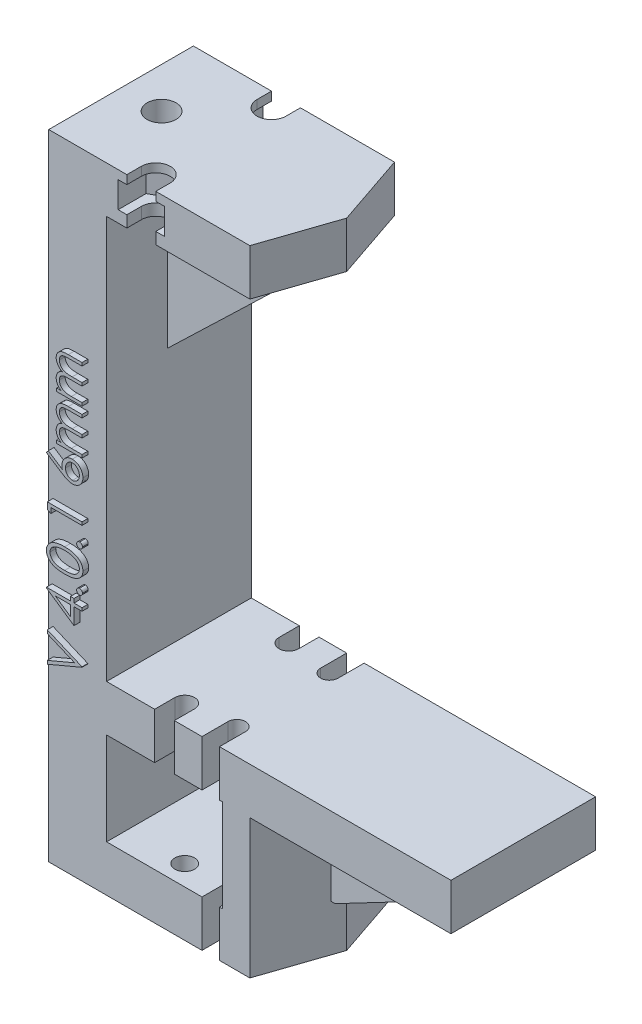
from build123d import *
from build123d.topology import SkipClean

# Parameters (mm, degrees)
BOSS_EXTRUDE2_DEPTH       = 12.5
BOSS_EXTRUDE3_DEPTH       = 25
CUT_EXTRUDE2_REACH        = 115.118
CUT_EXTRUDE3_REACH        = 115.118
BOSS_EXTRUDE5_DEPTH       = 2
CUT_EXTRUDE6_REACH        = 115.118
SKETCH30_W                = 10
SKETCH30_H                = 25
CUT_EXTRUDE8_DEPTH        = 8
CUT_EXTRUDE9_DEPTH        = 83.489769669
CUT_EXTRUDE9_DEPTH_BACK   = 83.489769669
BOSS_EXTRUDE6_DEPTH       = 1
BOSS_EXTRUDE7_DEPTH       = 40
BOSS_EXTRUDE17_DEPTH      = 2
CUT_EXTRUDE11_START       = -6
CUT_EXTRUDE11_DEPTH       = 4.5
SKETCH39_W                = 4
SKETCH39_H                = 16
BOSS_EXTRUDE18_DEPTH      = 2.5
F_5_0MM_DOWEL_HOLE1_D     = 5
F_5_0MM_DOWEL_HOLE1_DEPTH = 5
F_5_0MM_DOWEL_HOLE1_TIP   = 1.502151548
BOSS_EXTRUDE20_DEPTH      = 8


# Read off the part's stored shape, not the designer's step: Cut-Extrude11
with BuildPart() as part:
    # Sketch6 → Boss-Extrude2 (new, symmetric)
    with BuildSketch(Plane.XY):
        Polygon((-25, 54.805), (15, 54.805), (15, 46.805), (-15, 46.805), (-15, -46.805), (25, -46.805), (25, -54.805), (-25, -54.805), align=None)
    extrude(amount=BOSS_EXTRUDE2_DEPTH, both=True)

    # Sketch15 → Boss-Extrude3 (add)
    with BuildSketch(Plane.XY.offset(12.5)):
        Polygon((-15, -22.805), (15, -22.805), (15, -54.805), (5, -54.805), (5, -30.805), (-15, -30.805), align=None)
    extrude(amount=-BOSS_EXTRUDE3_DEPTH)

    # Sketch20 → Cut-Extrude2 (cut, up to next)
    with BuildSketch(Plane(origin=(0, 54.805, 0), x_dir=(1, 0, 0), z_dir=(0, 1, 0)), mode=Mode.PRIVATE) as cut_extrude2_sk1:
        with BuildLine():
            Line((-11.5, 12.5), (-11.5, 10))
            ThreePointArc((-11.5, 10), (-9, 7.5), (-6.5, 10))
            Line((-6.5, 10), (-6.5, 12.5))
            Line((-6.5, 12.5), (-11.5, 12.5))
        make_face()
    cut_extrude2_tool1 = extrude(cut_extrude2_sk1.sketch, amount=-CUT_EXTRUDE2_REACH, mode=Mode.PRIVATE) & part.part
    # Sketch20 → Cut-Extrude2 (cut, up to next)
    with BuildSketch(Plane(origin=(0, 54.805, 0), x_dir=(1, 0, 0), z_dir=(0, 1, 0)), mode=Mode.PRIVATE) as cut_extrude2_sk2:
        with BuildLine():
            Line((-6.5, -12.5), (-11.5, -12.5))
            Line((-11.5, -12.5), (-11.5, -10))
            ThreePointArc((-11.5, -10), (-9, -7.5), (-6.5, -10))
            Line((-6.5, -10), (-6.5, -12.5))
        make_face()
    cut_extrude2_tool2 = extrude(cut_extrude2_sk2.sketch, amount=-CUT_EXTRUDE2_REACH, mode=Mode.PRIVATE) & part.part
    add(cut_extrude2_tool1.solids().sort_by_distance((-9, 54.805, -10.233375))[0], mode=Mode.SUBTRACT)
    add(cut_extrude2_tool2.solids().sort_by_distance((-9, 54.805, 10.233375))[0], mode=Mode.SUBTRACT)

    # Cut-Extrude3: up to this face of the body (flat: up to its plane)
    cut_extrude3_end = Plane(part.part.faces().sort_by_distance((0, -22.805, 0))[0])
    # Sketch21 → Cut-Extrude3 (cut, up to the picked face)
    with BuildSketch(Plane.XZ.offset(54.805), mode=Mode.PRIVATE) as cut_extrude3_sk1:
        with BuildLine():
            Line((-6.7, 12.5), (-6.7, 9))
            ThreePointArc((-6.7, 9), (-5, 7.3), (-3.3, 9))
            Line((-3.3, 9), (-3.3, 12.5))
            Line((-3.3, 12.5), (-6.7, 12.5))
        make_face()
    cut_extrude3_tool1 = split(extrude(cut_extrude3_sk1.sketch, amount=-CUT_EXTRUDE3_REACH, mode=Mode.PRIVATE), bisect_by=cut_extrude3_end, keep=Keep.BOTH, mode=Mode.PRIVATE)
    # Sketch21 → Cut-Extrude3 (cut, up to the picked face)
    with BuildSketch(Plane.XZ.offset(54.805), mode=Mode.PRIVATE) as cut_extrude3_sk2:
        with BuildLine():
            Line((-3.3, -12.5), (-6.7, -12.5))
            Line((-6.7, -12.5), (-6.7, -9))
            ThreePointArc((-6.7, -9), (-5, -7.3), (-3.3, -9))
            Line((-3.3, -9), (-3.3, -12.5))
        make_face()
    cut_extrude3_tool2 = split(extrude(cut_extrude3_sk2.sketch, amount=-CUT_EXTRUDE3_REACH, mode=Mode.PRIVATE), bisect_by=cut_extrude3_end, keep=Keep.BOTH, mode=Mode.PRIVATE)
    add(cut_extrude3_tool1.solids().sort_by(Axis((-5, -54.805, 10.067524), (0, 1, 0)))[0], mode=Mode.SUBTRACT)
    add(cut_extrude3_tool2.solids().sort_by(Axis((-5, -54.805, -10.067524), (0, 1, 0)))[0], mode=Mode.SUBTRACT)

    # Sketch22 → Boss-Extrude5 (add, symmetric)
    with BuildSketch(Plane.XY):
        Polygon((-15, 21.805), (11, 46.805), (-15, 46.805), align=None)
    extrude(amount=BOSS_EXTRUDE5_DEPTH, both=True)

    # Cut-Extrude6: up to this face of the body (flat: up to its plane)
    cut_extrude6_end = Plane(part.part.faces().sort_by_distance((0.229244521, -22.805, 0))[0])
    # Sketch24 → Cut-Extrude6 (cut, up to the picked face)
    with BuildSketch(Plane.XZ.offset(54.805), mode=Mode.PRIVATE) as cut_extrude6_sk1:
        with BuildLine():
            Line((1.49, -12.5), (1.49, -8))
            ThreePointArc((1.49, -8), (3, -6.49), (4.51, -8))
            Line((4.51, -8), (4.51, -12.5))
            Line((4.51, -12.5), (1.49, -12.5))
        make_face()
    cut_extrude6_tool1 = split(extrude(cut_extrude6_sk1.sketch, amount=-CUT_EXTRUDE6_REACH, mode=Mode.PRIVATE), bisect_by=cut_extrude6_end, keep=Keep.BOTH, mode=Mode.PRIVATE)
    # Sketch24 → Cut-Extrude6 (cut, up to the picked face)
    with BuildSketch(Plane.XZ.offset(54.805), mode=Mode.PRIVATE) as cut_extrude6_sk2:
        with BuildLine():
            Line((4.51, 12.5), (1.49, 12.5))
            Line((1.49, 12.5), (1.49, 8))
            ThreePointArc((1.49, 8), (3, 6.49), (4.51, 8))
            Line((4.51, 8), (4.51, 12.5))
        make_face()
    cut_extrude6_tool2 = split(extrude(cut_extrude6_sk2.sketch, amount=-CUT_EXTRUDE6_REACH, mode=Mode.PRIVATE), bisect_by=cut_extrude6_end, keep=Keep.BOTH, mode=Mode.PRIVATE)
    add(cut_extrude6_tool1.solids().sort_by(Axis((3, -54.805, -9.647036), (0, 1, 0)))[0], mode=Mode.SUBTRACT)
    add(cut_extrude6_tool2.solids().sort_by(Axis((3, -54.805, 9.647036), (0, 1, 0)))[0], mode=Mode.SUBTRACT)

    # Sketch30 → Cut-Extrude8 (cut)
    with BuildSketch(Plane(origin=(0, -46.805, 0), x_dir=(1, 0, 0), z_dir=(0, 1, 0))):
        with Locations((20, 0)):
            Rectangle(SKETCH30_W, SKETCH30_H)
    extrude(amount=-CUT_EXTRUDE8_DEPTH, mode=Mode.SUBTRACT)

    # Sketch34 → Cut-Extrude9 (cut, two sides: drawn at the far end of the back side and taken through both)
    with BuildSketch(Plane(origin=(0, -22.805, 0), x_dir=(1, 0, 0), z_dir=(0, 1, 0)).offset(-CUT_EXTRUDE9_DEPTH_BACK)):
        Polygon((9.755, 12.5), (14, 0), (9.755, -12.5), (15, -12.5), (15, 12.5), align=None)
    extrude(amount=CUT_EXTRUDE9_DEPTH + CUT_EXTRUDE9_DEPTH_BACK, mode=Mode.SUBTRACT)

    # Sketch35 → Boss-Extrude6 (add)
    # profile 1 of 9: a face of its own
    with BuildSketch(Plane.XY.offset(12.5)):
        with BuildLine():
            Line((-22.634615385, 17.269230769), (-22.634615385, 17.807692308))
            Line((-22.634615385, 17.807692308), (-21.872596154, 17.807692308))
            add(Edge.make_bspline(
                [(-21.872596154, 17.807692308), (-21.939260614, 17.856179079), (-22.066996111, 17.949084381), (-22.235322312, 18.1014255), (-22.378170577, 18.253613121), (-22.453158357, 18.363213204), (-22.489182692, 18.415865385)],
                knots=[0, 0, 0, 0, 1.134379233, 2.173579362, 3.122582517, 4, 4, 4, 4], degree=3))
            add(Edge.make_bspline(
                [(-22.489182692, 18.415865385), (-22.523477604, 18.487633377), (-22.591468256, 18.629915491), (-22.660440071, 18.855205591), (-22.702825959, 19.085733596), (-22.708622599, 19.241404819), (-22.711538462, 19.319711538)],
                knots=[0, 0, 0, 0, 1.014936303, 2.012140481, 3.000054389, 4, 4, 4, 4], degree=3))
            add(Edge.make_bspline(
                [(-22.711538462, 19.319711538), (-22.709746507, 19.372670933), (-22.706200324, 19.477474728), (-22.683126386, 19.632762148), (-22.643239974, 19.783375365), (-22.587690322, 19.928433755), (-22.520389321, 20.065076782), (-22.441520642, 20.190446325), (-22.352811526, 20.30245663), (-22.251715073, 20.402902873), (-22.132621113, 20.492431534), (-21.993245652, 20.574208096), (-21.831579845, 20.65077394), (-21.714358593, 20.692943109), (-21.652644231, 20.715144231)],
                knots=[0, 0, 0, 0, 1.009731074, 1.9982035, 2.985760524, 3.974587072, 4.955028184, 5.885388378, 6.793242796, 7.673688873, 8.594941726, 9.625945874, 10.750113716, 12, 12, 12, 12], degree=3))
            add(Edge.make_bspline(
                [(-21.652644231, 20.715144231), (-21.695028488, 20.738649663), (-21.778434755, 20.784905052), (-21.896484081, 20.862565718), (-22.00687165, 20.943961513), (-22.109826129, 21.029654503), (-22.20452798, 21.120004571), (-22.292909205, 21.213555985), (-22.372522012, 21.312403764), (-22.465676161, 21.449129125), (-22.564941217, 21.626834374), (-22.648837086, 21.851761087), (-22.702266055, 22.084848957), (-22.708427236, 22.243302618), (-22.711538462, 22.323317308)],
                knots=[0, 0, 0, 0, 0.861026002, 1.694378253, 2.508904292, 3.297437177, 4.073006284, 4.833627155, 5.583069468, 6.325614666, 7.772320565, 9.187282923, 10.579656144, 12, 12, 12, 12], degree=3))
            add(Edge.make_bspline(
                [(-22.711538462, 22.323317308), (-22.708800813, 22.396841161), (-22.70344297, 22.54073448), (-22.660375554, 22.749864459), (-22.589095041, 22.945734478), (-22.488852441, 23.126268515), (-22.363482389, 23.289368748), (-22.214139706, 23.431680227), (-22.041369838, 23.55007394), (-21.880136821, 23.629223374), (-21.737524673, 23.681914306), (-21.615460368, 23.714821929), (-21.481004779, 23.743331908), (-21.334266049, 23.767504072), (-21.174947077, 23.784979438), (-21.002974661, 23.797970421), (-20.818199364, 23.806750853), (-20.690715767, 23.807372077), (-20.625, 23.807692308)],
                knots=[0, 0, 0, 0, 1.209392158, 2.366897878, 3.497663982, 4.628180075, 5.751982922, 6.871462727, 8.009245026, 9.185977379, 9.818124946, 10.509294143, 11.264649411, 12.079922034, 12.956003306, 13.901808055, 14.918415426, 16, 16, 16, 16], degree=3))
            Line((-20.625, 23.807692308), (-18.25, 23.807692308))
            Line((-18.25, 23.807692308), (-18.25, 23.269230769))
            Line((-18.25, 23.269230769), (-20.627403846, 23.269230769))
            add(Edge.make_bspline(
                [(-20.627403846, 23.269230769), (-20.683496341, 23.269097904), (-20.791297586, 23.268842556), (-20.946014988, 23.26421638), (-21.087050044, 23.255543984), (-21.214586843, 23.24524779), (-21.328585361, 23.231330295), (-21.428726359, 23.212954863), (-21.515466742, 23.193642495), (-21.611587244, 23.161482267), (-21.717531947, 23.110546589), (-21.830954892, 23.031547572), (-21.930458078, 22.933508005), (-22.016841526, 22.819678133), (-22.087129696, 22.690185901), (-22.137313417, 22.54744097), (-22.168382244, 22.392361242), (-22.171478124, 22.285007677), (-22.173076923, 22.229567308)],
                knots=[0, 0, 0, 0, 1.253367865, 2.408782419, 3.458086102, 4.410454771, 5.267690823, 6.022776742, 6.685072793, 7.251272234, 8.28433411, 9.300106008, 10.325693114, 11.39283262, 12.482417211, 13.60372085, 14.762494729, 16, 16, 16, 16], degree=3))
            add(Edge.make_bspline(
                [(-22.173076923, 22.229567308), (-22.16997183, 22.161617134), (-22.163840459, 22.02744157), (-22.117743069, 21.830434893), (-22.041126709, 21.64313437), (-21.936341225, 21.466804552), (-21.807618816, 21.30609247), (-21.655294615, 21.167323536), (-21.482742522, 21.052776353), (-21.32307314, 20.975194285), (-21.179638783, 20.926180609), (-21.054327211, 20.893835916), (-20.911520556, 20.868524428), (-20.752893327, 20.8452455), (-20.577094809, 20.829534991), (-20.385210505, 20.815656481), (-20.175926859, 20.809077948), (-20.03085208, 20.808165864), (-19.955528846, 20.807692308)],
                knots=[0, 0, 0, 0, 1.091136677, 2.154576964, 3.231646693, 4.331257757, 5.439166191, 6.528231045, 7.628049365, 8.756709726, 9.369482423, 10.061167346, 10.833871401, 11.698739631, 12.636505159, 13.668922441, 14.789697963, 16, 16, 16, 16], degree=3))
            Line((-19.955528846, 20.807692308), (-18.25, 20.807692308))
            Line((-18.25, 20.807692308), (-18.25, 20.269230769))
            Line((-18.25, 20.269230769), (-20.479567308, 20.269230769))
            add(Edge.make_bspline(
                [(-20.479567308, 20.269230769), (-20.54247014, 20.269094602), (-20.663488866, 20.268832629), (-20.837032312, 20.264244659), (-20.994885583, 20.255524728), (-21.136865264, 20.245443812), (-21.262713168, 20.230940575), (-21.373104451, 20.214466924), (-21.467760922, 20.195011474), (-21.57158701, 20.162802895), (-21.685945136, 20.113560705), (-21.807983755, 20.034450534), (-21.914604324, 19.935263645), (-22.007034555, 19.820195313), (-22.082563185, 19.689716261), (-22.13505501, 19.545269522), (-22.167080197, 19.38922123), (-22.171040318, 19.281407719), (-22.173076923, 19.225961538)],
                knots=[0, 0, 0, 0, 1.320285835, 2.540097241, 3.643286278, 4.638464947, 5.527188413, 6.301437306, 6.980978976, 7.552872752, 8.580906713, 9.583871393, 10.589652407, 11.624542289, 12.671761011, 13.738681301, 14.837052193, 16, 16, 16, 16], degree=3))
            add(Edge.make_bspline(
                [(-22.173076923, 19.225961538), (-22.170453269, 19.160790907), (-22.165224419, 19.030908152), (-22.118160076, 18.84010453), (-22.044438314, 18.655844312), (-21.942166243, 18.481061128), (-21.815474903, 18.320490875), (-21.666504635, 18.179853397), (-21.497243672, 18.062067556), (-21.339930706, 17.983138428), (-21.200047184, 17.932537066), (-21.080645905, 17.899361166), (-20.948314964, 17.870241312), (-20.802780158, 17.848840171), (-20.64469108, 17.828115401), (-20.473236398, 17.818125243), (-20.288570334, 17.808401202), (-20.161074488, 17.807934402), (-20.094951923, 17.807692308)],
                knots=[0, 0, 0, 0, 1.09880202, 2.189873405, 3.297736452, 4.440485332, 5.596193377, 6.739822772, 7.886349079, 9.066114917, 9.699498033, 10.395421758, 11.156987371, 11.985484089, 12.878178647, 13.847820956, 14.883825601, 16, 16, 16, 16], degree=3))
            Line((-20.094951923, 17.807692308), (-18.25, 17.807692308))
            Line((-18.25, 17.807692308), (-18.25, 17.269230769))
            Line((-18.25, 17.269230769), (-22.634615385, 17.269230769))
        make_face()
    # profile 2 of 9: a face of its own
    with BuildSketch(Plane.XY.offset(12.5)):
        with BuildLine():
            Line((-22.634615385, 9.5), (-22.634615385, 10.038461538))
            Line((-22.634615385, 10.038461538), (-21.872596154, 10.038461538))
            add(Edge.make_bspline(
                [(-21.872596154, 10.038461538), (-21.939260614, 10.08694831), (-22.066996111, 10.179853612), (-22.235322312, 10.33219473), (-22.378170577, 10.484382352), (-22.453158357, 10.593982435), (-22.489182692, 10.646634615)],
                knots=[0, 0, 0, 0, 1.134379233, 2.173579362, 3.122582517, 4, 4, 4, 4], degree=3))
            add(Edge.make_bspline(
                [(-22.489182692, 10.646634615), (-22.523477604, 10.718402608), (-22.591468256, 10.860684722), (-22.660440071, 11.085974821), (-22.702825959, 11.316502826), (-22.708622599, 11.47217405), (-22.711538462, 11.550480769)],
                knots=[0, 0, 0, 0, 1.014936303, 2.012140481, 3.000054389, 4, 4, 4, 4], degree=3))
            add(Edge.make_bspline(
                [(-22.711538462, 11.550480769), (-22.709746507, 11.603440164), (-22.706200324, 11.708243958), (-22.683126386, 11.863531379), (-22.643239974, 12.014144596), (-22.587690322, 12.159202985), (-22.520389321, 12.295846013), (-22.441520642, 12.421215556), (-22.352811526, 12.533225861), (-22.251715073, 12.633672104), (-22.132621113, 12.723200764), (-21.993245652, 12.804977327), (-21.831579845, 12.881543171), (-21.714358593, 12.923712339), (-21.652644231, 12.945913462)],
                knots=[0, 0, 0, 0, 1.009731074, 1.9982035, 2.985760524, 3.974587072, 4.955028184, 5.885388378, 6.793242796, 7.673688873, 8.594941726, 9.625945874, 10.750113716, 12, 12, 12, 12], degree=3))
            add(Edge.make_bspline(
                [(-21.652644231, 12.945913462), (-21.695028488, 12.969418894), (-21.778434755, 13.015674283), (-21.896484081, 13.093334949), (-22.00687165, 13.174730744), (-22.109826129, 13.260423733), (-22.20452798, 13.350773802), (-22.292909205, 13.444325216), (-22.372522012, 13.543172995), (-22.465676161, 13.679898355), (-22.564941217, 13.857603604), (-22.648837086, 14.082530318), (-22.702266055, 14.315618188), (-22.708427236, 14.474071849), (-22.711538462, 14.554086538)],
                knots=[0, 0, 0, 0, 0.861026002, 1.694378253, 2.508904292, 3.297437177, 4.073006284, 4.833627155, 5.583069468, 6.325614666, 7.772320565, 9.187282923, 10.579656144, 12, 12, 12, 12], degree=3))
            add(Edge.make_bspline(
                [(-22.711538462, 14.554086538), (-22.708800813, 14.627610392), (-22.70344297, 14.771503711), (-22.660375554, 14.98063369), (-22.589095041, 15.176503709), (-22.488852441, 15.357037746), (-22.363482389, 15.520137979), (-22.214139706, 15.662449458), (-22.041369838, 15.780843171), (-21.880136821, 15.859992605), (-21.737524673, 15.912683537), (-21.615460368, 15.945591159), (-21.481004779, 15.974101139), (-21.334266049, 15.998273303), (-21.174947077, 16.015748669), (-21.002974661, 16.028739652), (-20.818199364, 16.037520084), (-20.690715767, 16.038141308), (-20.625, 16.038461538)],
                knots=[0, 0, 0, 0, 1.209392158, 2.366897878, 3.497663982, 4.628180075, 5.751982922, 6.871462727, 8.009245026, 9.185977379, 9.818124946, 10.509294143, 11.264649411, 12.079922034, 12.956003306, 13.901808055, 14.918415426, 16, 16, 16, 16], degree=3))
            Line((-20.625, 16.038461538), (-18.25, 16.038461538))
            Line((-18.25, 16.038461538), (-18.25, 15.5))
            Line((-18.25, 15.5), (-20.627403846, 15.5))
            add(Edge.make_bspline(
                [(-20.627403846, 15.5), (-20.683496341, 15.499867134), (-20.791297586, 15.499611787), (-20.946014988, 15.494985611), (-21.087050044, 15.486313215), (-21.214586843, 15.476017021), (-21.328585361, 15.462099526), (-21.428726359, 15.443724094), (-21.515466742, 15.424411726), (-21.611587244, 15.392251498), (-21.717531947, 15.34131582), (-21.830954892, 15.262316803), (-21.930458078, 15.164277236), (-22.016841526, 15.050447363), (-22.087129696, 14.920955131), (-22.137313417, 14.778210201), (-22.168382244, 14.623130473), (-22.171478124, 14.515776908), (-22.173076923, 14.460336538)],
                knots=[0, 0, 0, 0, 1.253367865, 2.408782419, 3.458086102, 4.410454771, 5.267690823, 6.022776742, 6.685072793, 7.251272234, 8.28433411, 9.300106008, 10.325693114, 11.39283262, 12.482417211, 13.60372085, 14.762494729, 16, 16, 16, 16], degree=3))
            add(Edge.make_bspline(
                [(-22.173076923, 14.460336538), (-22.16997183, 14.392386365), (-22.163840459, 14.258210801), (-22.117743069, 14.061204124), (-22.041126709, 13.873903601), (-21.936341225, 13.697573783), (-21.807618816, 13.536861701), (-21.655294615, 13.398092767), (-21.482742522, 13.283545584), (-21.32307314, 13.205963516), (-21.179638783, 13.15694984), (-21.054327211, 13.124605147), (-20.911520556, 13.099293659), (-20.752893327, 13.076014731), (-20.577094809, 13.060304222), (-20.385210505, 13.046425711), (-20.175926859, 13.039847179), (-20.03085208, 13.038935095), (-19.955528846, 13.038461538)],
                knots=[0, 0, 0, 0, 1.091136677, 2.154576964, 3.231646693, 4.331257757, 5.439166191, 6.528231045, 7.628049365, 8.756709726, 9.369482423, 10.061167346, 10.833871401, 11.698739631, 12.636505159, 13.668922441, 14.789697963, 16, 16, 16, 16], degree=3))
            Line((-19.955528846, 13.038461538), (-18.25, 13.038461538))
            Line((-18.25, 13.038461538), (-18.25, 12.5))
            Line((-18.25, 12.5), (-20.479567308, 12.5))
            add(Edge.make_bspline(
                [(-20.479567308, 12.5), (-20.54247014, 12.499863832), (-20.663488866, 12.49960186), (-20.837032312, 12.495013889), (-20.994885583, 12.486293959), (-21.136865264, 12.476213043), (-21.262713168, 12.461709805), (-21.373104451, 12.445236155), (-21.467760922, 12.425780704), (-21.57158701, 12.393572126), (-21.685945136, 12.344329936), (-21.807983755, 12.265219765), (-21.914604324, 12.166032876), (-22.007034555, 12.050964543), (-22.082563185, 11.920485491), (-22.13505501, 11.776038753), (-22.167080197, 11.619990461), (-22.171040318, 11.51217695), (-22.173076923, 11.456730769)],
                knots=[0, 0, 0, 0, 1.320285835, 2.540097241, 3.643286278, 4.638464947, 5.527188413, 6.301437306, 6.980978976, 7.552872752, 8.580906713, 9.583871393, 10.589652407, 11.624542289, 12.671761011, 13.738681301, 14.837052193, 16, 16, 16, 16], degree=3))
            add(Edge.make_bspline(
                [(-22.173076923, 11.456730769), (-22.170453269, 11.391560137), (-22.165224419, 11.261677383), (-22.118160076, 11.070873761), (-22.044438314, 10.886613543), (-21.942166243, 10.711830359), (-21.815474903, 10.551260106), (-21.666504635, 10.410622628), (-21.497243672, 10.292836786), (-21.339930706, 10.213907659), (-21.200047184, 10.163306297), (-21.080645905, 10.130130397), (-20.948314964, 10.101010543), (-20.802780158, 10.079609402), (-20.64469108, 10.058884632), (-20.473236398, 10.048894474), (-20.288570334, 10.039170433), (-20.161074488, 10.038703633), (-20.094951923, 10.038461538)],
                knots=[0, 0, 0, 0, 1.09880202, 2.189873405, 3.297736452, 4.440485332, 5.596193377, 6.739822772, 7.886349079, 9.066114917, 9.699498033, 10.395421758, 11.156987371, 11.985484089, 12.878178647, 13.847820956, 14.883825601, 16, 16, 16, 16], degree=3))
            Line((-20.094951923, 10.038461538), (-18.25, 10.038461538))
            Line((-18.25, 10.038461538), (-18.25, 9.5))
            Line((-18.25, 9.5), (-22.634615385, 9.5))
        make_face()
    # profile 3 of 9: a face of its own
    with BuildSketch(Plane.XY.offset(12.5)):
        with BuildLine():
            Line((-24.403846154, 7.269230769), (-24.078125, 7.683894231))
            Line((-24.078125, 7.683894231), (-21.653846154, 6.098557692))
            add(Edge.make_bspline(
                [(-21.653846154, 6.098557692), (-21.670669915, 6.204106739), (-21.703486563, 6.409992087), (-21.708900184, 6.618390771), (-21.711538462, 6.719951923)],
                knots=[0, 0, 0, 0, 1.025318673, 2, 2, 2, 2], degree=3))
            add(Edge.make_bspline(
                [(-21.711538462, 6.719951923), (-21.709899413, 6.780933345), (-21.706672995, 6.900973461), (-21.681843536, 7.077213691), (-21.642714775, 7.24656616), (-21.585676611, 7.408328899), (-21.512815472, 7.563082672), (-21.425491544, 7.711715012), (-21.319196668, 7.851434042), (-21.200454525, 7.984031063), (-21.068947951, 8.104438983), (-20.929372943, 8.210959201), (-20.781740538, 8.300924423), (-20.626083938, 8.372600215), (-20.463621598, 8.429881866), (-20.293719906, 8.47065943), (-20.116092105, 8.495036871), (-19.995268777, 8.498328138), (-19.933894231, 8.5)],
                knots=[0, 0, 0, 0, 1.043709831, 2.054511743, 3.041122595, 4.01515914, 4.98481438, 5.965901842, 6.960491961, 7.985277438, 9.0096037, 10.00832444, 10.987059228, 11.962929573, 12.936966118, 13.931840027, 14.949438142, 16, 16, 16, 16], degree=3))
            add(Edge.make_bspline(
                [(-19.933894231, 8.5), (-19.849925882, 8.497566321), (-19.684696042, 8.492777416), (-19.444095149, 8.44485764), (-19.215016278, 8.37095082), (-19.001423329, 8.26362202), (-18.801836938, 8.132834364), (-18.625572893, 7.971381106), (-18.468373459, 7.787272661), (-18.336976256, 7.578987195), (-18.229652901, 7.354862474), (-18.152570648, 7.119400295), (-18.105113004, 6.874897039), (-18.099163435, 6.708946225), (-18.096153846, 6.625)],
                knots=[0, 0, 0, 0, 1.031403119, 2.029557249, 3.004870281, 3.983165322, 4.960181699, 5.929903783, 6.912123683, 7.928973898, 8.949315281, 9.960468141, 10.968302741, 12, 12, 12, 12], degree=3))
            add(Edge.make_bspline(
                [(-18.096153846, 6.625), (-18.098766183, 6.544259401), (-18.103940764, 6.38432641), (-18.150276973, 6.149119892), (-18.224845886, 5.922714882), (-18.329732025, 5.7080176), (-18.459978665, 5.508802902), (-18.615685436, 5.329151298), (-18.797068655, 5.173877592), (-19.000160456, 5.043494415), (-19.218092402, 4.939644242), (-19.445725188, 4.862493147), (-19.682103161, 4.817189725), (-19.84235951, 4.810873596), (-19.923076923, 4.807692308)],
                knots=[0, 0, 0, 0, 1.012172929, 2.004937354, 2.995255351, 3.995689452, 4.993936421, 5.973737378, 6.968231049, 7.979117505, 8.993136101, 9.989812463, 10.987515067, 12, 12, 12, 12], degree=3))
            add(Edge.make_bspline(
                [(-19.923076923, 4.807692308), (-19.984867637, 4.809717642), (-20.111032469, 4.813852988), (-20.30211366, 4.842727371), (-20.4976298, 4.889124162), (-20.663494132, 4.941084584), (-20.799371027, 4.99598563), (-20.908919868, 5.041675698), (-21.021653136, 5.098545406), (-21.141436512, 5.159185488), (-21.265182968, 5.229054406), (-21.394960687, 5.30502409), (-21.528705706, 5.389194921), (-21.619467184, 5.448200914), (-21.665865385, 5.478365385)],
                knots=[0, 0, 0, 0, 1.173818275, 2.396712641, 3.66331629, 4.989737886, 5.693666774, 6.447286557, 7.243889047, 8.091586357, 8.998013824, 9.943181721, 10.948533338, 12, 12, 12, 12], degree=3))
            Line((-21.665865385, 5.478365385), (-24.403846154, 7.269230769))
        make_face()
        with BuildLine():
            add(Edge.make_bspline(
                [(-21.096153846, 6.606971154), (-21.094832934, 6.561259995), (-21.092252808, 6.471972824), (-21.07694369, 6.34105097), (-21.049079349, 6.216739962), (-21.010443012, 6.099003717), (-20.962808931, 5.987115923), (-20.901690222, 5.883293888), (-20.830500874, 5.785401188), (-20.749369676, 5.695001893), (-20.660601819, 5.613020503), (-20.565508182, 5.542425535), (-20.466398904, 5.481529667), (-20.362441082, 5.432018063), (-20.25367571, 5.393463624), (-20.140602696, 5.365575201), (-20.022463889, 5.350054483), (-19.942351027, 5.347472372), (-19.901442308, 5.346153846)],
                knots=[0, 0, 0, 0, 1.129656352, 2.206547016, 3.251334079, 4.271920891, 5.265058649, 6.249872215, 7.241923875, 8.251504132, 9.246416584, 10.222533834, 11.173322129, 12.116503788, 13.062124155, 14.020151864, 14.989013135, 16, 16, 16, 16], degree=3))
            add(Edge.make_bspline(
                [(-19.901442308, 5.346153846), (-19.860906568, 5.347265633), (-19.781025922, 5.349456545), (-19.663769289, 5.368109959), (-19.551188433, 5.397925494), (-19.443706454, 5.440996044), (-19.339259979, 5.493335342), (-19.241109444, 5.560516861), (-19.146075545, 5.637621725), (-19.058573873, 5.727648697), (-18.977340886, 5.825003493), (-18.906043773, 5.92879751), (-18.84575467, 6.037467959), (-18.795798488, 6.15070186), (-18.759023612, 6.269898927), (-18.730870445, 6.393123702), (-18.715478724, 6.522051569), (-18.712869121, 6.609338027), (-18.711538462, 6.653846154)],
                knots=[0, 0, 0, 0, 0.989367052, 1.949669134, 2.891858276, 3.827522767, 4.772653562, 5.738670152, 6.725809442, 7.756636004, 8.798867547, 9.819240912, 10.826537776, 11.829883227, 12.835515726, 13.868058748, 14.912904531, 16, 16, 16, 16], degree=3))
            add(Edge.make_bspline(
                [(-18.711538462, 6.653846154), (-18.712869225, 6.698354208), (-18.715479031, 6.785640522), (-18.730869278, 6.914569427), (-18.759027885, 7.037790369), (-18.795783003, 7.157001359), (-18.845812463, 7.270183625), (-18.905666483, 7.378759084), (-18.977778041, 7.481571437), (-19.058434397, 7.578989588), (-19.146575547, 7.668642423), (-19.240253141, 7.747560711), (-19.340045333, 7.812643334), (-19.443295772, 7.867057848), (-19.551252632, 7.909651499), (-19.663751768, 7.939613822), (-19.781030493, 7.958227552), (-19.860908107, 7.960423911), (-19.901442308, 7.961538462)],
                knots=[0, 0, 0, 0, 1.087281468, 2.132306021, 3.165025708, 4.170830268, 5.174347389, 6.181816599, 7.194310624, 8.23672049, 9.267723423, 10.261267456, 11.222032883, 12.171822355, 13.107646935, 14.049997283, 15.01046367, 16, 16, 16, 16], degree=3))
            add(Edge.make_bspline(
                [(-19.901442308, 7.961538462), (-19.942404395, 7.960595102), (-20.022799652, 7.958743595), (-20.14054985, 7.937801967), (-20.254250218, 7.908757903), (-20.363186077, 7.864901258), (-20.466927872, 7.807924405), (-20.565998396, 7.738523967), (-20.661162096, 7.658240784), (-20.749543383, 7.565497376), (-20.830412917, 7.464560809), (-20.901592315, 7.357153427), (-20.96235134, 7.245233743), (-21.010295021, 7.127225204), (-21.048918996, 7.004715604), (-21.076844343, 6.876858999), (-21.092212901, 6.743564451), (-21.094823466, 6.653082186), (-21.096153846, 6.606971154)],
                knots=[0, 0, 0, 0, 0.978259475, 1.920005202, 2.851759169, 3.7803069, 4.719124913, 5.675758531, 6.668034766, 7.691045932, 8.733780038, 9.756656648, 10.768121246, 11.773215211, 12.79725739, 13.836288844, 14.897342417, 16, 16, 16, 16], degree=3))
        make_face(mode=Mode.SUBTRACT)
    # profile 4 of 9: a face of its own
    with BuildSketch(Plane.XY.offset(12.5)):
        Polygon((-24.25, -1.147836538), (-24.25, -0.038461538), (-18.25, -0.038461538), (-18.25, -0.576923077), (-23.634615385, -0.576923077), (-23.634615385, -1.5), align=None)
    # profile 5 of 9: a face of its own
    with BuildSketch(Plane.XY.offset(12.5)):
        with BuildLine():
            add(Edge.make_bspline(
                [(-19.173076923, -3.769230769), (-19.171091494, -3.735818977), (-19.167199294, -3.670319064), (-19.140496425, -3.575623416), (-19.093081578, -3.489918285), (-19.029888244, -3.413577294), (-18.953267107, -3.350651905), (-18.868245549, -3.301547302), (-18.772757105, -3.275077041), (-18.706877662, -3.271213193), (-18.673076923, -3.269230769)],
                knots=[0, 0, 0, 0, 1.020151414, 1.999887582, 2.974338812, 3.990962822, 5.007586832, 5.987933904, 6.967670073, 8, 8, 8, 8], degree=3))
            add(Edge.make_bspline(
                [(-18.673076923, -3.269230769), (-18.640082695, -3.271274058), (-18.57501856, -3.275303392), (-18.480332316, -3.301559245), (-18.395213248, -3.350592295), (-18.318771705, -3.413977657), (-18.254052036, -3.489461742), (-18.207265803, -3.575891553), (-18.178559122, -3.670079602), (-18.174926676, -3.735776099), (-18.173076923, -3.769230769)],
                knots=[0, 0, 0, 0, 1.009624703, 1.990965087, 2.972917375, 3.991206001, 5.017354006, 5.993400798, 6.978178195, 8, 8, 8, 8], degree=3))
            add(Edge.make_bspline(
                [(-18.173076923, -3.769230769), (-18.174859529, -3.802709533), (-18.178339643, -3.86806885), (-18.207852551, -3.961905744), (-18.253605582, -4.048862347), (-18.318889524, -4.124326817), (-18.394817845, -4.18822583), (-18.480918523, -4.2350835), (-18.574747202, -4.263615845), (-18.640029244, -4.267343647), (-18.673076923, -4.269230769)],
                knots=[0, 0, 0, 0, 1.022258411, 1.995716197, 2.98297171, 4.009558169, 5.028281891, 6.00474573, 6.989943903, 8, 8, 8, 8], degree=3))
            add(Edge.make_bspline(
                [(-18.673076923, -4.269230769), (-18.706933002, -4.267410028), (-18.773032842, -4.263855253), (-18.867659884, -4.235096978), (-18.953662923, -4.188166329), (-19.029771346, -4.124728509), (-19.093521007, -4.048401145), (-19.139917796, -3.962179079), (-19.167415645, -3.867825581), (-19.171157102, -3.802665687), (-19.173076923, -3.769230769)],
                knots=[0, 0, 0, 0, 1.032775665, 2.016367738, 2.991239715, 4.008302682, 5.025365648, 6.011011707, 6.979408107, 8, 8, 8, 8], degree=3))
        make_face()
    # profile 6 of 9: a face of its own
    with BuildSketch(Plane.XY.offset(12.5)):
        with BuildLine():
            add(Edge.make_bspline(
                [(-21.247596154, -9.346153846), (-21.343763104, -9.345591529), (-21.530568792, -9.344499221), (-21.802771035, -9.332347642), (-22.058131531, -9.312161341), (-22.2966625, -9.284497272), (-22.518425529, -9.250832167), (-22.722827956, -9.20589132), (-22.9108159, -9.154783702), (-23.083002111, -9.095550791), (-23.241707287, -9.028715086), (-23.389862864, -8.955968859), (-23.52725581, -8.874435523), (-23.656039225, -8.788738253), (-23.774246225, -8.695540865), (-23.883238776, -8.59684169), (-23.982097725, -8.490666728), (-24.07089077, -8.378045781), (-24.148749314, -8.259742133), (-24.217752138, -8.138988579), (-24.274589397, -8.013627524), (-24.321083839, -7.885309274), (-24.359038325, -7.753763383), (-24.385109169, -7.619023433), (-24.401483733, -7.480777089), (-24.403051209, -7.387466604), (-24.403846154, -7.340144231)],
                knots=[0, 0, 0, 0, 1.646148282, 3.197666765, 4.66315463, 6.030252048, 7.307778049, 8.501004361, 9.610818041, 10.641065266, 11.615491391, 12.557119604, 13.464013759, 14.348536654, 15.203310953, 16.038349431, 16.863300206, 17.683791446, 18.490318933, 19.285717724, 20.06220424, 20.843281102, 21.620494212, 22.403315558, 23.190242141, 24, 24, 24, 24], degree=3))
            add(Edge.make_bspline(
                [(-24.403846154, -7.340144231), (-24.403184011, -7.292403126), (-24.40186658, -7.19741513), (-24.383322948, -7.057486305), (-24.359388145, -6.919994801), (-24.321000663, -6.787026636), (-24.275065063, -6.656067637), (-24.214453767, -6.530374493), (-24.148534277, -6.405509571), (-24.068118043, -6.287145316), (-23.979244872, -6.171745221), (-23.878351101, -6.063569681), (-23.768228979, -5.95985344), (-23.646422458, -5.864513819), (-23.514799194, -5.773464695), (-23.372255805, -5.690162385), (-23.219108188, -5.612874352), (-23.056066311, -5.540147786), (-22.878775073, -5.476550325), (-22.688340287, -5.420007098), (-22.483037474, -5.373660357), (-22.2640103, -5.335332416), (-22.030173709, -5.305582638), (-21.782001479, -5.283931253), (-21.519338352, -5.272490378), (-21.339753411, -5.270336216), (-21.247596154, -5.269230769)],
                knots=[0, 0, 0, 0, 0.810910589, 1.61342667, 2.396193133, 3.181089899, 3.963115317, 4.752255436, 5.550715454, 6.36105385, 7.181178335, 8.024612154, 8.872680183, 9.750181803, 10.651284446, 11.591556747, 12.554036451, 13.566402641, 14.62422919, 15.753422176, 16.94128843, 18.199818041, 19.531985927, 20.947085226, 22.433341622, 24, 24, 24, 24], degree=3))
            add(Edge.make_bspline(
                [(-21.247596154, -5.269230769), (-21.155841687, -5.270360537), (-20.976661658, -5.27256677), (-20.715168068, -5.283685878), (-20.46833354, -5.306111482), (-20.235894914, -5.33375386), (-20.01774442, -5.372510188), (-19.814024206, -5.419208359), (-19.62401301, -5.47241398), (-19.449072236, -5.536987491), (-19.286313286, -5.608021287), (-19.134291753, -5.685226384), (-18.991786008, -5.768058606), (-18.859815568, -5.857742204), (-18.738497958, -5.954650065), (-18.627998136, -6.05829361), (-18.526462639, -6.16741365), (-18.436610349, -6.283486506), (-18.355581867, -6.402953252), (-18.287270195, -6.52783086), (-18.228082139, -6.654923377), (-18.179690445, -6.785499701), (-18.14216212, -6.919358229), (-18.116363441, -7.05694397), (-18.098228951, -7.197434877), (-18.096847943, -7.292409731), (-18.096153846, -7.340144231)],
                knots=[0, 0, 0, 0, 1.561645053, 3.049612875, 4.452756685, 5.778837748, 7.032101753, 8.221335837, 9.334924186, 10.387562255, 11.392109817, 12.355697819, 13.287721948, 14.19548756, 15.068665045, 15.927346723, 16.771751757, 17.602390507, 18.423119567, 19.225778204, 20.022010933, 20.807278863, 21.593079439, 22.384715467, 23.188155646, 24, 24, 24, 24], degree=3))
            add(Edge.make_bspline(
                [(-18.096153846, -7.340144231), (-18.096953313, -7.387465569), (-18.098529705, -7.480774011), (-18.114838958, -7.619035313), (-18.141059822, -7.753233786), (-18.177773997, -7.884031655), (-18.22271373, -8.012099946), (-18.28126285, -8.135693658), (-18.348692879, -8.256186538), (-18.425484279, -8.373258889), (-18.513467177, -8.484704058), (-18.610766452, -8.591175), (-18.719877187, -8.689898515), (-18.839081549, -8.782287797), (-18.968056572, -8.868891041), (-19.106888809, -8.949719822), (-19.255815319, -9.023991593), (-19.415774756, -9.091969174), (-19.589183067, -9.152238885), (-19.777650209, -9.205270345), (-19.983090447, -9.247624944), (-20.20446072, -9.283527014), (-20.442210834, -9.312295813), (-20.696426807, -9.332339259), (-20.966625901, -9.344489996), (-21.152230327, -9.345589108), (-21.247596154, -9.346153846)],
                knots=[0, 0, 0, 0, 0.810927267, 1.598990287, 2.382942141, 3.152806972, 3.926217614, 4.706701772, 5.493896336, 6.292070767, 7.104102563, 7.925577746, 8.761822141, 9.623241997, 10.509042271, 11.423174113, 12.375371989, 13.360203808, 14.400680605, 15.520553799, 16.714061498, 17.994519714, 19.364400916, 20.818312473, 22.365209998, 24, 24, 24, 24], degree=3))
        make_face()
        with BuildLine():
            add(Edge.make_bspline(
                [(-21.25, -8.807692308), (-21.169859694, -8.807483051), (-21.014323096, -8.807076926), (-20.788701112, -8.796774227), (-20.577909913, -8.782433921), (-20.382031768, -8.764392991), (-20.201751265, -8.737374133), (-20.036318913, -8.706719587), (-19.886040925, -8.669951329), (-19.749604048, -8.62623337), (-19.625076282, -8.576434359), (-19.509138521, -8.522158056), (-19.400416685, -8.463333193), (-19.299174551, -8.398753987), (-19.206649691, -8.327143662), (-19.120496813, -8.251822083), (-19.043712237, -8.169396052), (-18.951605787, -8.055394706), (-18.856431673, -7.904884071), (-18.773552195, -7.715249727), (-18.721468101, -7.520389344), (-18.714844504, -7.388130082), (-18.711538462, -7.322115385)],
                knots=[0, 0, 0, 0, 1.459098681, 2.831824031, 4.11146945, 5.306290378, 6.412266529, 7.42953815, 8.369053297, 9.227277979, 10.03601793, 10.809473603, 11.557037441, 12.285528272, 12.993193355, 13.685654407, 14.36688038, 15.041354379, 16.352855396, 17.594313975, 18.799247529, 20, 20, 20, 20], degree=3))
            add(Edge.make_bspline(
                [(-18.711538462, -7.322115385), (-18.714433297, -7.255718553), (-18.720212699, -7.123160415), (-18.770653042, -6.92847903), (-18.852653022, -6.741045054), (-18.946336056, -6.593124146), (-19.036124672, -6.480900833), (-19.112589838, -6.400465014), (-19.198233217, -6.32664622), (-19.29063069, -6.256630717), (-19.391555316, -6.192415303), (-19.500519627, -6.134021312), (-19.617826818, -6.080735584), (-19.699717795, -6.050377218), (-19.741586538, -6.034855769)],
                knots=[0, 0, 0, 0, 1.353621445, 2.702441307, 4.075953605, 5.516772412, 6.261413105, 7.007624062, 7.778524365, 8.566925914, 9.372323995, 10.217594641, 11.088702136, 12, 12, 12, 12], degree=3))
            add(Edge.make_bspline(
                [(-19.741586538, -6.034855769), (-19.795123235, -6.016767024), (-19.903825688, -5.980039115), (-20.072449091, -5.932704645), (-20.249368115, -5.895426818), (-20.433525458, -5.861889619), (-20.626279231, -5.838998666), (-20.827033032, -5.820573843), (-21.035938225, -5.809721237), (-21.177872495, -5.80837595), (-21.25, -5.807692308)],
                knots=[0, 0, 0, 0, 0.884706709, 1.796334032, 2.740027952, 3.714592787, 4.726048262, 5.777819803, 6.87074269, 8, 8, 8, 8], degree=3))
            add(Edge.make_bspline(
                [(-21.25, -5.807692308), (-21.322115839, -5.808635489), (-21.463189835, -5.810480554), (-21.669792431, -5.817533104), (-21.866022878, -5.835744946), (-22.052726545, -5.855972008), (-22.228869925, -5.885795812), (-22.395927577, -5.917952066), (-22.551829954, -5.961154097), (-22.699017639, -6.007302446), (-22.835819346, -6.060119699), (-22.962869531, -6.118262921), (-23.080793265, -6.1803505), (-23.189226195, -6.247818329), (-23.288797281, -6.319726648), (-23.377215398, -6.398653685), (-23.458781601, -6.479586988), (-23.550223336, -6.594691206), (-23.644194815, -6.744157534), (-23.728320624, -6.931427062), (-23.778108547, -7.125242949), (-23.78501303, -7.256538557), (-23.788461538, -7.322115385)],
                knots=[0, 0, 0, 0, 1.313483664, 2.569454835, 3.763100662, 4.901599063, 5.988328865, 7.015709358, 7.99797933, 8.932480776, 9.824041341, 10.666387587, 11.475829342, 12.24921787, 12.990555181, 13.709176526, 14.405678811, 15.080244297, 16.38186033, 17.610124501, 18.806354173, 20, 20, 20, 20], degree=3))
            add(Edge.make_bspline(
                [(-23.788461538, -7.322115385), (-23.78500445, -7.38848648), (-23.778083976, -7.521349584), (-23.728550878, -7.717235245), (-23.64444095, -7.905769891), (-23.550404383, -8.055729104), (-23.459132198, -8.169434999), (-23.381449059, -8.250123368), (-23.297353903, -8.326489555), (-23.204008242, -8.396245538), (-23.103122835, -8.460441808), (-22.995806963, -8.521540043), (-22.879652573, -8.575090529), (-22.755222453, -8.625049416), (-22.618778072, -8.668840297), (-22.467956326, -8.705188436), (-22.30212891, -8.738279118), (-22.120531175, -8.762109803), (-21.924611224, -8.783094304), (-21.713280962, -8.796616796), (-21.486884212, -8.807124123), (-21.330542894, -8.807499119), (-21.25, -8.807692308)],
                knots=[0, 0, 0, 0, 1.207546505, 2.417292871, 3.651582144, 4.952510111, 5.626719005, 6.30238548, 6.989136872, 7.692112372, 8.420316868, 9.164734959, 9.937886623, 10.746308695, 11.604196049, 12.543341915, 13.568754172, 14.680483261, 15.875568977, 17.154711427, 18.534182925, 20, 20, 20, 20], degree=3))
        make_face(mode=Mode.SUBTRACT)
    # profile 7 of 9: a face of its own
    with BuildSketch(Plane.XY.offset(12.5)):
        with BuildLine():
            add(Edge.make_bspline(
                [(-19.173076923, -10.692307692), (-19.171091494, -10.6588959), (-19.167199294, -10.593395987), (-19.140496425, -10.498700339), (-19.093081578, -10.412995208), (-19.029888244, -10.336654217), (-18.953267107, -10.273728828), (-18.868245549, -10.224624225), (-18.772757105, -10.198153964), (-18.706877662, -10.194290116), (-18.673076923, -10.192307692)],
                knots=[0, 0, 0, 0, 1.020151414, 1.999887582, 2.974338812, 3.990962822, 5.007586832, 5.987933904, 6.967670073, 8, 8, 8, 8], degree=3))
            add(Edge.make_bspline(
                [(-18.673076923, -10.192307692), (-18.640082695, -10.194350981), (-18.57501856, -10.198380315), (-18.480332316, -10.224636168), (-18.395213248, -10.273669218), (-18.318771705, -10.33705458), (-18.254052036, -10.412538665), (-18.207265803, -10.498968476), (-18.178559122, -10.593156525), (-18.174926676, -10.658853022), (-18.173076923, -10.692307692)],
                knots=[0, 0, 0, 0, 1.009624703, 1.990965087, 2.972917375, 3.991206001, 5.017354006, 5.993400798, 6.978178195, 8, 8, 8, 8], degree=3))
            add(Edge.make_bspline(
                [(-18.173076923, -10.692307692), (-18.174859529, -10.725786456), (-18.178339643, -10.791145773), (-18.207852551, -10.884982667), (-18.253605582, -10.97193927), (-18.318889524, -11.04740374), (-18.394817845, -11.111302753), (-18.480918523, -11.158160423), (-18.574747202, -11.186692768), (-18.640029244, -11.19042057), (-18.673076923, -11.192307692)],
                knots=[0, 0, 0, 0, 1.022258411, 1.995716197, 2.98297171, 4.009558169, 5.028281891, 6.00474573, 6.989943903, 8, 8, 8, 8], degree=3))
            add(Edge.make_bspline(
                [(-18.673076923, -11.192307692), (-18.706933002, -11.190486951), (-18.773032842, -11.186932176), (-18.867659884, -11.158173902), (-18.953662923, -11.111243253), (-19.029771346, -11.047805433), (-19.093521007, -10.971478068), (-19.139917796, -10.885256002), (-19.167415645, -10.790902504), (-19.171157102, -10.72574261), (-19.173076923, -10.692307692)],
                knots=[0, 0, 0, 0, 1.032775665, 2.016367738, 2.991239715, 4.008302682, 5.025365648, 6.011011707, 6.979408107, 8, 8, 8, 8], degree=3))
        make_face()
    # profile 8 of 9: a face of its own
    with BuildSketch(Plane.XY.offset(12.5)):
        Polygon((-24.403846154, -12.993990385), (-24.403846154, -12.884615385), (-20.25, -12.884615385), (-20.25, -12.192307692), (-19.634615385, -12.192307692), (-19.634615385, -12.884615385), (-18.25, -12.884615385), (-18.25, -13.423076923), (-19.634615385, -13.423076923), (-19.634615385, -16.269230769), align=None)
        Polygon((-20.25, -13.423076923), (-22.855769231, -13.423076923), (-20.25, -15.211538462), align=None, mode=Mode.SUBTRACT)
    # profile 9 of 9: a face of its own
    with BuildSketch(Plane.XY.offset(12.5)):
        Polygon((-24.25, -24.346153846), (-24.25, -23.769230769), (-19.521634615, -21.769230769), (-24.25, -19.769230769), (-24.25, -19.192307692), (-18.25, -21.730769231), (-18.25, -21.807692308), align=None)
    extrude(amount=BOSS_EXTRUDE6_DEPTH)

    # 3DSketch1 → Boss-Extrude7 (add)
    with BuildSketch(Plane(origin=(4.51, -22.805, 12.5), x_dir=(0, -0.304775727103784, -0.9524241471993241), z_dir=(-1, 0, 0))):
        Polygon((0, 0), (2.438205817, 7.619393178), (26.248809497, 0), (23.81060368, -7.619393178), align=None)
    extrude(amount=-BOSS_EXTRUDE7_DEPTH)

    # Cut-Extrude11 outline → Cut-Extrude11 (cut)
    with BuildSketch(Plane(origin=(0, 54.805, 0), x_dir=(1, 0, 0), z_dir=(0, 1, 0)).offset(CUT_EXTRUDE11_START)):
        with BuildLine():
            Line((-9, -5.381197846), (-13, -7.690598923))
            Line((-13, -7.690598923), (-13, -12.5))
            Line((-13, -12.5), (-11.5, -12.5))
            Line((-11.5, -12.5), (-11.5, -10))
            ThreePointArc((-11.5, -10), (-9, -7.5), (-6.5, -10))
            Line((-6.5, -10), (-6.5, -12.5))
            Line((-6.5, -12.5), (-5, -12.5))
            Line((-5, -12.5), (-5, -7.690598923))
            Line((-5, -7.690598923), (-9, -5.381197846))
        make_face()
    cut_extrude11 = extrude(amount=CUT_EXTRUDE11_DEPTH, mode=Mode.SUBTRACT)

    # Mirror1: Cut-Extrude11 across plane
    add(cut_extrude11.mirror(Plane.XY), mode=Mode.SUBTRACT)



with BuildPart() as body_2:
    # Sketch37 → Boss-Extrude17 (new, symmetric)
    with BuildSketch(Plane.XY):
        Polygon((14, -30.805), (44.51, -30.805), (14, -46.805), align=None)
    extrude(amount=BOSS_EXTRUDE17_DEPTH, both=True)


with BuildPart() as part_1:
    add(part.part)

    add(body_2.part)  # Boss-Extrude18 merges body 2
    # Sketch39 → Boss-Extrude18 (add)
    with BuildSketch(Plane.ZY.offset(-14)):
        with Locations((0, -38.805)):
            Rectangle(SKETCH39_W, SKETCH39_H)
    extrude(amount=BOSS_EXTRUDE18_DEPTH)

    # Ø5.0mm Dowel Hole1
    with Locations(Plane(origin=(0, 54.805, 0), x_dir=(1, 0, 0), z_dir=(0, 1, 0))):
        with Locations((-18, 0)):
            Hole(F_5_0MM_DOWEL_HOLE1_D / 2, depth=F_5_0MM_DOWEL_HOLE1_DEPTH)
            with Locations((0, 0, -(F_5_0MM_DOWEL_HOLE1_DEPTH + F_5_0MM_DOWEL_HOLE1_TIP / 2))):  # 118° drill point
                Cone(0, F_5_0MM_DOWEL_HOLE1_D / 2, F_5_0MM_DOWEL_HOLE1_TIP, mode=Mode.SUBTRACT)

    # Sketch44 → Boss-Extrude20 (add)
    with SkipClean():  # the faces are left unmerged after this step: merging them gives an invalid solid
        with BuildSketch(Plane.XZ.offset(54.805)):
            with BuildLine():
                Line((-6.7, 12.5), (-6.7, 9))
                ThreePointArc((-6.7, 9), (-5, 10.7), (-3.3, 9))
                Line((-3.3, 9), (-3.3, 12.5))
                Line((-3.3, 12.5), (-6.7, 12.5))
            make_face()
            with BuildLine():
                ThreePointArc((-3.3, -9), (-5, -10.7), (-6.7, -9))
                Line((-6.7, -9), (-6.7, -12.5))
                Line((-6.7, -12.5), (-3.3, -12.5))
                Line((-3.3, -12.5), (-3.3, -9))
            make_face()
        extrude(amount=-BOSS_EXTRUDE20_DEPTH)


solid = part_1.part
